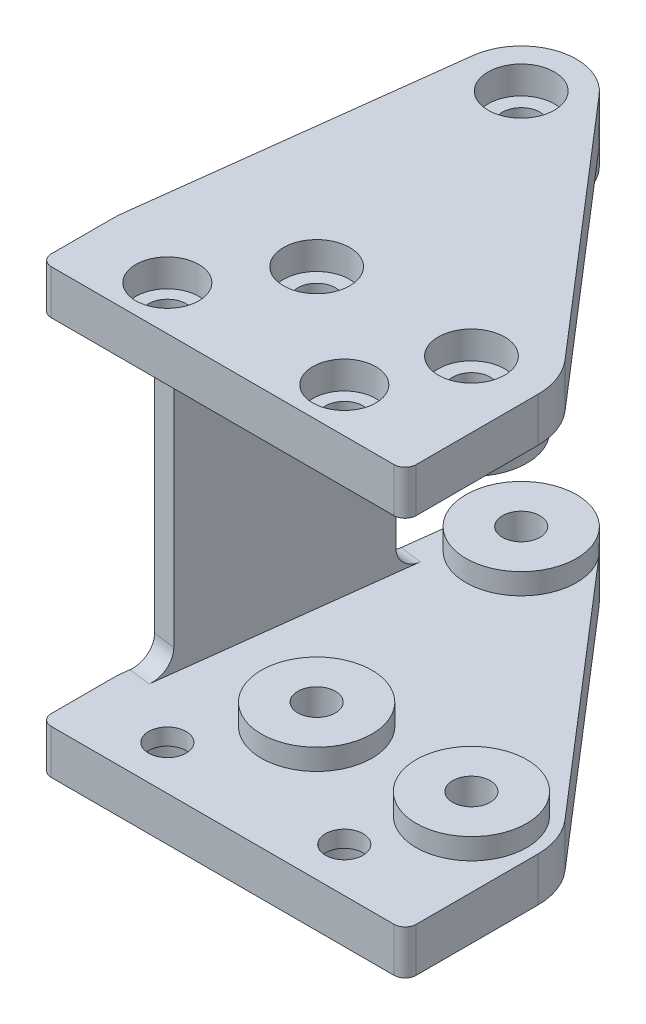
from build123d import *

# Parameters (mm, degrees)
SKETCH_1_R          = 1.7
EXTRUDE_1_DEPTH     = 4
EXTRUDE_START       = 1.9
SKETCH_2_R          = 5
SKETCH_2_R_2        = 1.7
EXTRUDE_2_DEPTH     = 1.9
EXTRUDE_3_DEPTH     = 16
FILLET_1_R          = 1
FILLET_2_R          = 10
SKETCH_5_R          = 3
SKETCH_5_R_2        = 2.85
CUT_EXTRUDE_1_DEPTH = 2.5
FILLET_3_R          = 2


with BuildPart() as part:
    # 草图1 → 凸台-拉伸1 (new body)
    with BuildSketch(Plane(origin=(0, 0, 0), x_dir=(1, 0, 0), z_dir=(0, 1, 0))):
        with BuildLine():
            Line((-15.5, 3), (-15.5, -4))
            Line((-15.5, -4), (15.5, -4))
            Line((15.5, -4), (17.5, -4))
            Line((17.5, -4), (17.5, 8))
            ThreePointArc((17.5, 8), (17.124551632, 10.089119178), (16.045193687, 11.916786227))
            Line((16.045193687, 11.916786227), (-3.212338594, 34.263988522))
            ThreePointArc((-3.212338594, 34.263988522), (-8.449526575, 35.78527666), (-11.962215367, 31.613529665))
            Line((-11.962215367, 31.613529665), (-15.5, 3))
        make_face()
        with Locations((-8, 0)):
            Circle(SKETCH_1_R, mode=Mode.SUBTRACT)
        with Locations((-2.5, 8)):
            Circle(SKETCH_1_R, mode=Mode.SUBTRACT)
        with Locations((8, 0)):
            Circle(SKETCH_1_R, mode=Mode.SUBTRACT)
        with Locations((11.5, 8)):
            Circle(SKETCH_1_R, mode=Mode.SUBTRACT)
        with Locations((-7, 31)):
            Circle(SKETCH_1_R, mode=Mode.SUBTRACT)
    extrude(amount=EXTRUDE_1_DEPTH)

    # 草图2 → 凸台-拉伸2 (add)
    # profile 1 of 3: a face of its own
    with BuildSketch(Plane.XZ.offset(EXTRUDE_START)):
        with Locations((11.5, -8)):
            Circle(SKETCH_2_R)
        with Locations((11.5, -8)):
            Circle(SKETCH_2_R_2, mode=Mode.SUBTRACT)
    # profile 2 of 3: a face of its own
    with BuildSketch(Plane.XZ.offset(EXTRUDE_START)):
        with Locations((-2.5, -8)):
            Circle(SKETCH_2_R)
        with Locations((-2.5, -8)):
            Circle(SKETCH_2_R_2, mode=Mode.SUBTRACT)
    # profile 3 of 3: a face of its own
    with BuildSketch(Plane.XZ.offset(EXTRUDE_START)):
        with Locations((-7, -31)):
            Circle(SKETCH_2_R)
        with Locations((-7, -31)):
            Circle(SKETCH_2_R_2, mode=Mode.SUBTRACT)
    extrude(amount=-EXTRUDE_2_DEPTH)

    # 草图3 → 凸台-拉伸3 (add)
    with BuildSketch(Plane.XZ):
        Polygon((-15.131882201, -5.97732922), (-12.923175407, -23.841304542), (-10.93828926, -23.595892676), (-13.146996054, -5.731917354), align=None)
    extrude(amount=EXTRUDE_3_DEPTH)

    # 圆角1
    fillet_1_edges = [part.edges().sort_by_distance(p)[0] for p in [
        (-15.5, 2, 4),
        (17.5, 2, 4),
    ]]
    fillet(fillet_1_edges, radius=FILLET_1_R)

    # 圆角2
    fillet_2_edges = [part.edges().sort_by_distance(p)[0] for p in [
        (-15.5, 2, -3),
    ]]
    fillet(fillet_2_edges, radius=FILLET_2_R)

    # 草图5 → 切除-拉伸1 (cut)
    with BuildSketch(Plane(origin=(0, 4, 0), x_dir=(1, 0, 0), z_dir=(0, 1, 0))):
        with Locations((-7, 31)):
            Circle(SKETCH_5_R)
        with Locations((-2.5, 8)):
            Circle(SKETCH_5_R)
        with Locations((-8, 0)):
            Circle(SKETCH_5_R_2)
        with Locations((8, 0)):
            Circle(SKETCH_5_R_2)
        with Locations((11.5, 8)):
            Circle(SKETCH_5_R)
    extrude(amount=-CUT_EXTRUDE_1_DEPTH, mode=Mode.SUBTRACT)

    # 镜向1: part across plane


with BuildPart() as part_1:
    add(part.part)
    add(part.part.mirror(Plane(origin=(0, -16, 0), x_dir=(0, 0, 1), z_dir=(0, -1, 0))))

    # 圆角3
    fillet_3_edges = [part_1.edges().sort_by_distance(p)[0] for p in [
        (-14.139439128, 0, -5.854623287),
        (-14.139439128, -32, -5.854623287),
        (-11.930732333, 0, -23.718598609),
        (-11.930732333, -32, -23.718598609),
    ]]
    fillet(fillet_3_edges, radius=FILLET_3_R)


solid = part_1.part
